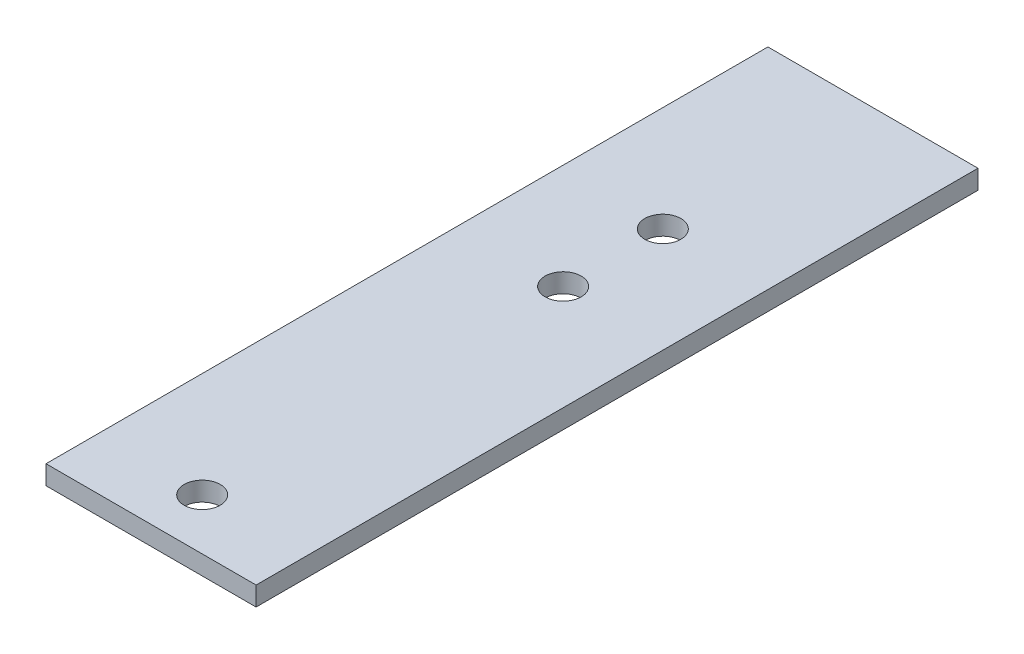
from build123d import *

# Parameters (mm, degrees)
SKETCH1_W           = 38.1
SKETCH1_H           = 120
BOSS_EXTRUDE1_DEPTH = 38.1
SKETCH2_W           = 34.925
SKETCH2_H           = 34.925
CUT_EXTRUDE1_DEPTH  = 130.767142413
SKETCH18_W          = 3.175
SKETCH18_H          = 3.175
CUT_EXTRUDE3_DEPTH  = 130.767142413
SKETCH19_R          = 3
CUT_EXTRUDE4_DEPTH  = 121.228267267


with BuildPart() as part:
    # Sketch1 → Boss-Extrude1 (new body)
    with BuildSketch(Plane.XZ.offset(34.925)):
        with Locations((15.875, -55)):
            Rectangle(SKETCH1_W, SKETCH1_H)
    extrude(amount=-BOSS_EXTRUDE1_DEPTH)

    # Sketch2 → Cut-Extrude1 (cut, through all)
    with BuildSketch(Plane(origin=(0, 0, -115), x_dir=(-1, 0, 0), z_dir=(0, 0, -1))):
        with Locations((-17.4625, -17.4625)):
            Rectangle(SKETCH2_W, SKETCH2_H)
    extrude(amount=-CUT_EXTRUDE1_DEPTH, mode=Mode.SUBTRACT)

    # Sketch18 → Cut-Extrude3 (cut, through all)
    with BuildSketch(Plane.XY.offset(5)):
        with Locations((-1.5875, 1.5875)):
            Rectangle(SKETCH18_W, SKETCH18_H)
    extrude(amount=-CUT_EXTRUDE3_DEPTH, mode=Mode.SUBTRACT)


with BuildPart() as body_2:
    # of the pieces the cut leaves, the one that is kept (cut_extrude3_keep)
    add(part.part.solids().sort_by_distance((34.925, 0, -115))[0])

    # Sketch19 → Cut-Extrude4 (cut, through all)
    with BuildSketch(Plane.XZ):
        with Locations((17.4625, -80.07)):
            Circle(SKETCH19_R)
        with Locations((17.4625, -63.5)):
            Circle(SKETCH19_R)
        with Locations((17.4625, -3.5)):
            Circle(SKETCH19_R)
    extrude(amount=-CUT_EXTRUDE4_DEPTH, mode=Mode.SUBTRACT)


solid = body_2.part
